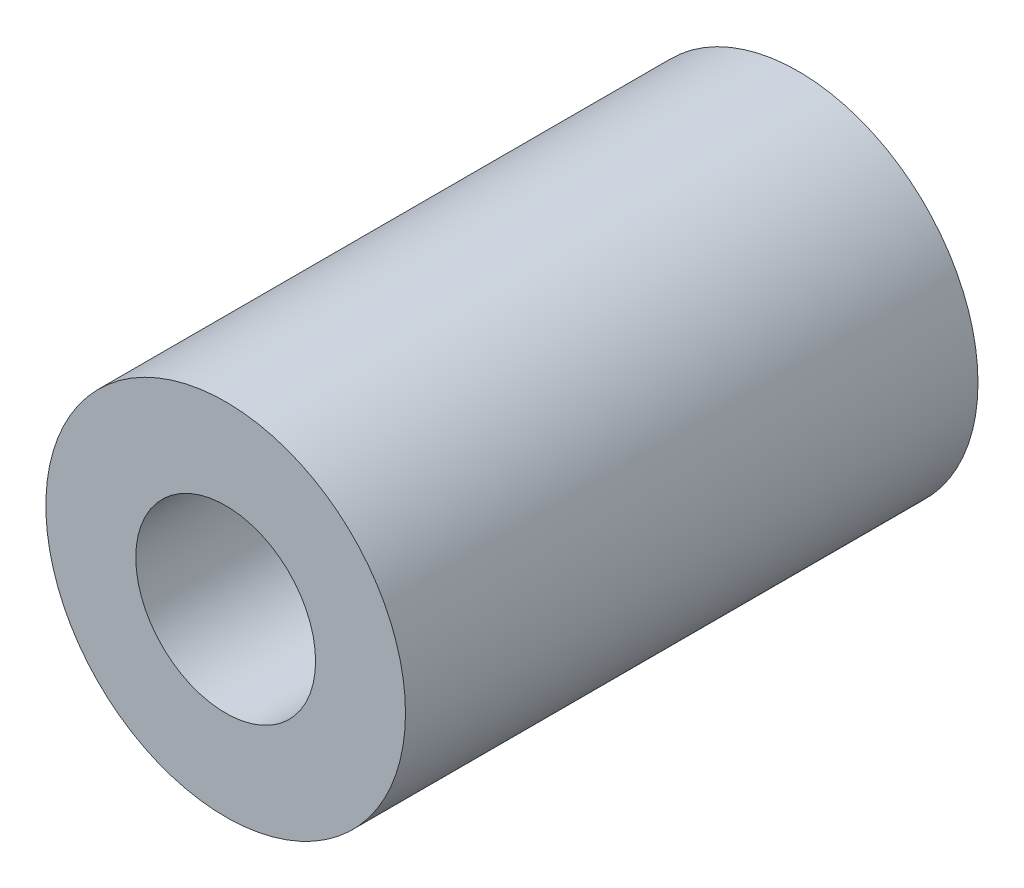
from build123d import *

# Parameters (mm, degrees)
SKETCH1_R           = 3.175
SKETCH1_R_2         = 1.5875
BOSS_EXTRUDE1_DEPTH = 10.1092


with BuildPart() as part:
    # Sketch1 → Boss-Extrude1 (new body)
    with BuildSketch(Plane.XY):
        Circle(SKETCH1_R)
        Circle(SKETCH1_R_2, mode=Mode.SUBTRACT)
    extrude(amount=BOSS_EXTRUDE1_DEPTH)


solid = part.part
